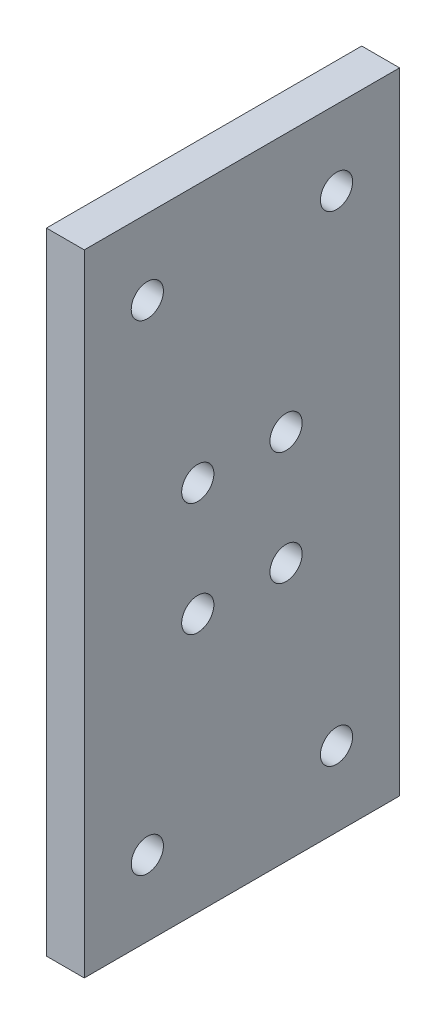
from build123d import *

# Parameters (mm, degrees)
SKETCH1_W           = 100
SKETCH1_H           = 50
SKETCH1_R           = 2.555
BOSS_EXTRUDE1_DEPTH = 6


with BuildPart() as part:
    # Sketch1 → Boss-Extrude1 (new body)
    with BuildSketch(Plane.YZ):
        Rectangle(SKETCH1_W, SKETCH1_H)
        with Locations((-9, 7)):
            Circle(SKETCH1_R, mode=Mode.SUBTRACT)
        with Locations((-9, -7)):
            Circle(SKETCH1_R, mode=Mode.SUBTRACT)
        with Locations((9, -7)):
            Circle(SKETCH1_R, mode=Mode.SUBTRACT)
        with Locations((9, 7)):
            Circle(SKETCH1_R, mode=Mode.SUBTRACT)
        with Locations((-38.1, 15)):
            Circle(SKETCH1_R, mode=Mode.SUBTRACT)
        with Locations((-38.1, -15)):
            Circle(SKETCH1_R, mode=Mode.SUBTRACT)
        with Locations((38.1, 15)):
            Circle(SKETCH1_R, mode=Mode.SUBTRACT)
        with Locations((38.1, -15)):
            Circle(SKETCH1_R, mode=Mode.SUBTRACT)
    extrude(amount=BOSS_EXTRUDE1_DEPTH)


solid = part.part
